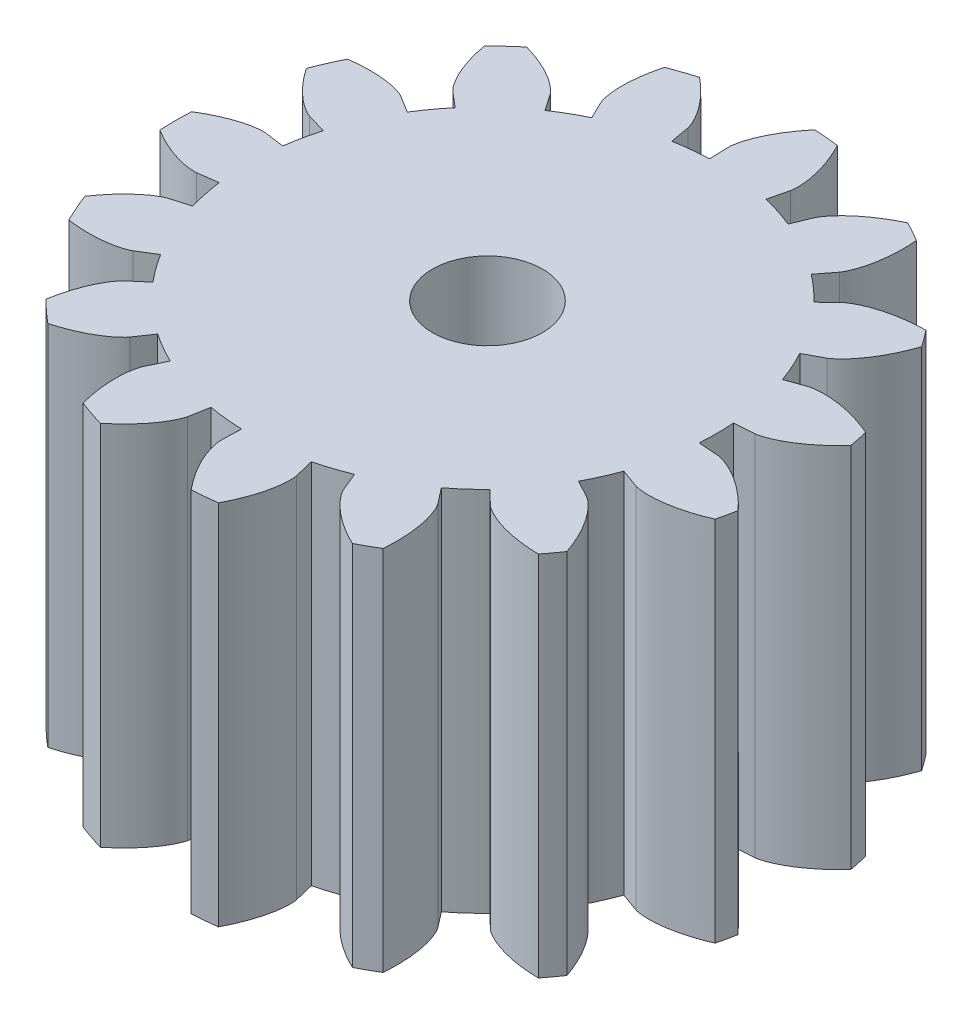
from build123d import *

# Parameters (mm, degrees)
IZIM2_R                     = 8.5
Y_KSEKLIK_EKSTR_ZYON1_DEPTH = 10
KES_EKSTR_ZYON1_DEPTH       = 10
DAIRESEL_KAPLAMA1_DEPTH     = 10
IZIM4_R                     = 1.5
KES_EKSTR_ZYON2_DEPTH       = 10


# Read off the part's stored shape, not the designer's step: Dairesel Kaplama1
with BuildPart() as part:
    # Çizim2 → Yükseklik-Ekstrüzyon1 (new body)
    with BuildSketch(Plane(origin=(0, 0, 0), x_dir=(1, 0, 0), z_dir=(0, 1, 0))):
        with Locations(Location((0, 0, 0), (0, 0, 270))):
            Circle(IZIM2_R)
    extrude(amount=Y_KSEKLIK_EKSTR_ZYON1_DEPTH)

    # Çizim3 → Kes-Ekstrüzyon1 (cut)
    with BuildSketch(Plane(origin=(0, 0, 0), x_dir=(1, 0, 0), z_dir=(0, 1, 0))):
        with BuildLine():
            add(Edge.make_bspline(
                [(6.778329888, 0.507587872), (6.781151553, 0.507844299), (6.78905244, 0.508702265), (6.803933483, 0.510871839), (6.828112192, 0.515186865), (6.872789151, 0.52486054), (6.925921196, 0.539194402), (6.98535488, 0.558049096), (7.048582566, 0.580958795), (7.102206918, 0.602179379), (7.155264884, 0.624857332), (7.207707286, 0.648803305), (7.270713626, 0.679398072), (7.340331798, 0.715586875), (7.396390413, 0.746971028), (7.439228346, 0.772141506), (7.458914159, 0.783964013)],
                knots=[0, 0, 0, 0, 0, 0.005376749, 0.015083688, 0.02853182, 0.046610139, 0.092110525, 0.119476176, 0.146842496, 0.174208854, 0.201574956, 0.228941013, 0.256307345, 0.307035032, 0.35065054, 0.35065054, 0.35065054, 0.35065054, 0.35065054], degree=4))
            Line((6.778329888, 0.507587872), (6.776027931, 0.507415492))
            ThreePointArc((6.776027931, 0.507415492), (6.790255326, 0.253885024), (6.795, 0))
            ThreePointArc((6.795, 0), (6.790255326, -0.253885024), (6.776027931, -0.507415492))
            Line((6.776027931, -0.507415492), (6.778329888, -0.507587872))
            add(Edge.make_bspline(
                [(6.778329888, -0.507587872), (6.781151553, -0.507844299), (6.78905244, -0.508702265), (6.803933483, -0.510871839), (6.828112192, -0.515186865), (6.872789151, -0.52486054), (6.925921196, -0.539194402), (6.98535488, -0.558049096), (7.048582566, -0.580958795), (7.102206918, -0.602179379), (7.155264884, -0.624857332), (7.207707286, -0.648803305), (7.270713626, -0.679398072), (7.340331798, -0.715586875), (7.396390413, -0.746971028), (7.439228346, -0.772141506), (7.458914159, -0.783964013)],
                knots=[0, 0, 0, 0, 0, 0.005376749, 0.015083688, 0.02853182, 0.046610139, 0.092110525, 0.119476176, 0.146842496, 0.174208854, 0.201574956, 0.228941013, 0.256307345, 0.307035032, 0.35065054, 0.35065054, 0.35065054, 0.35065054, 0.35065054], degree=4))
            ThreePointArc((7.458914159, -0.783964013), (7.489721496, -0.392519942), (7.5, 0))
            ThreePointArc((7.5, 0), (7.489721496, 0.392519942), (7.458914159, 0.783964013))
        make_face()
        with BuildLine():
            ThreePointArc((6.795, 0), (6.790255326, 0.253885024), (6.776027931, 0.507415492))
            Line((6.776027931, 0.507415492), (6.232549605, 0.466717708))
            ThreePointArc((6.232549605, 0.466717708), (6.245635878, 0.233521913), (6.25, 0))
            ThreePointArc((6.25, 0), (6.245635878, -0.233521913), (6.232549605, -0.466717708))
            Line((6.232549605, -0.466717708), (6.776027931, -0.507415492))
            ThreePointArc((6.776027931, -0.507415492), (6.790255326, -0.253885024), (6.795, 0))
        make_face()
        with BuildLine():
            add(Edge.make_bspline(
                [(7.458914159, 0.783964013), (7.46393172, 0.786977358), (7.493607067, 0.804898134), (7.547467466, 0.838496906), (7.624836133, 0.889663526), (7.718514983, 0.955731482), (7.811457228, 1.026089784), (7.90016559, 1.096716979), (7.990429253, 1.173683928), (8.072801253, 1.246571514), (8.162893515, 1.332136353), (8.234967779, 1.402336669), (8.307514849, 1.478047302), (8.342539168, 1.515364187), (8.360317377, 1.534631343)],
                knots=[0.35065054, 0.35065054, 0.35065054, 0.35065054, 0.35065054, 0.361767352, 0.416499661, 0.471231937, 0.525964282, 0.580696615, 0.635428982, 0.690161387, 0.744893688, 0.799626082, 0.854358408, 0.909090915, 0.909090915, 0.909090915, 0.909090915, 0.909090915], degree=4))
            ThreePointArc((7.458914159, 0.783964013), (7.489721496, 0.392519942), (7.5, 0))
            ThreePointArc((7.5, 0), (7.489721496, -0.392519942), (7.458914159, -0.783964013))
            add(Edge.make_bspline(
                [(7.458914159, -0.783964013), (7.46393172, -0.786977358), (7.493607067, -0.804898134), (7.547467466, -0.838496906), (7.624836133, -0.889663526), (7.718514983, -0.955731482), (7.811457228, -1.026089784), (7.90016559, -1.096716979), (7.990429253, -1.173683928), (8.072801253, -1.246571514), (8.162893515, -1.332136353), (8.234967779, -1.402336669), (8.307514849, -1.478047302), (8.342539168, -1.515364187), (8.360317377, -1.534631343)],
                knots=[0.35065054, 0.35065054, 0.35065054, 0.35065054, 0.35065054, 0.361767352, 0.416499661, 0.471231937, 0.525964282, 0.580696615, 0.635428982, 0.690161387, 0.744893688, 0.799626082, 0.854358408, 0.909090915, 0.909090915, 0.909090915, 0.909090915, 0.909090915], degree=4))
            ThreePointArc((8.360317377, -1.534631343), (8.465007315, -0.770487605), (8.5, 0))
            ThreePointArc((8.5, 0), (8.465007315, 0.770487605), (8.360317377, 1.534631343))
        make_face()
    extrude(amount=KES_EKSTR_ZYON1_DEPTH, mode=Mode.SUBTRACT)

    # Dairesel Kaplama1 outline → Dairesel Kaplama1 (cut)
    with BuildSketch(Plane(origin=(0, 0, 0), x_dir=(1, 0, 0), z_dir=(0, 1, 0))):
        with BuildLine():
            add(Edge.make_bspline(
                [(5.975031867, -3.271632687), (5.977505288, -3.27301462), (5.98437414, -3.277011991), (5.997086205, -3.28504666), (6.017419475, -3.298823), (6.05429927, -3.325832098), (6.097007702, -3.360537482), (6.143634178, -3.40193596), (6.19207733, -3.448582028), (6.232434424, -3.489778985), (6.271681333, -3.532076945), (6.309850147, -3.575282926), (6.35496529, -3.628859624), (6.407490408, -3.694812939), (6.466533083, -3.774324793), (6.530674632, -3.867311635), (6.592949632, -3.964981273), (6.651657262, -4.063439976), (6.707946928, -4.1655185), (6.76025938, -4.266120594), (6.811414062, -4.37314694), (6.857018576, -4.473236774), (6.904519597, -4.588047968), (6.939604905, -4.675969394), (6.971743014, -4.76478739), (6.987872452, -4.81067419), (6.99448009, -4.82982901)],
                knots=[0, 0, 0, 0, 0, 0.005376749, 0.015083688, 0.02853182, 0.046610139, 0.092110525, 0.119476176, 0.146842496, 0.174208854, 0.201574956, 0.228941013, 0.256307345, 0.307035032, 0.361767352, 0.416499661, 0.471231937, 0.525964282, 0.580696615, 0.635428982, 0.690161387, 0.744893688, 0.799626082, 0.854358408, 0.896146756, 0.896146756, 0.896146756, 0.896146756, 0.896146756], degree=4))
            ThreePointArc((6.99448009, -4.82982901), (7.747434148, -3.496750508), (8.249034838, -2.050225412))
            add(Edge.make_bspline(
                [(6.387941041, -2.344223498), (6.390623058, -2.345136914), (6.398189844, -2.347566703), (6.412666798, -2.351637365), (6.436510228, -2.357529759), (6.481259298, -2.366864174), (6.535627944, -2.375380289), (6.597592211, -2.382329526), (6.66467179, -2.387117491), (6.722291262, -2.389542512), (6.77998608, -2.39040579), (6.837634303, -2.389860302), (6.907637472, -2.387537579), (6.991796502, -2.382439966), (7.090392585, -2.37311341), (7.202414349, -2.358559528), (7.316667144, -2.339485128), (7.429119291, -2.317231668), (7.542643556, -2.290759177), (7.652409345, -2.262318965), (7.766174584, -2.228719698), (7.871071202, -2.195637286), (7.988176933, -2.15411374), (8.082117127, -2.119465976), (8.178393178, -2.080150513), (8.225444786, -2.060372236), (8.249034838, -2.050225412)],
                knots=[0, 0, 0, 0, 0, 0.005376749, 0.015083688, 0.02853182, 0.046610139, 0.092110525, 0.119476176, 0.146842496, 0.174208854, 0.201574956, 0.228941013, 0.256307345, 0.307035032, 0.361767352, 0.416499661, 0.471231937, 0.525964282, 0.580696615, 0.635428982, 0.690161387, 0.744893688, 0.799626082, 0.854358408, 0.908033413, 0.908033413, 0.908033413, 0.908033413, 0.908033413], degree=4))
            Line((6.387941041, -2.344223498), (5.872722549, -2.15957141))
            ThreePointArc((5.872722549, -2.15957141), (5.698833084, -2.593036967), (5.493060161, -3.012307094))
            Line((5.493060161, -3.012307094), (5.975031867, -3.271632687))
        make_face()
        with BuildLine():
            add(Edge.make_bspline(
                [(4.116944298, -5.469982532), (4.118641798, -5.472251021), (4.12329093, -5.478696616), (4.131635984, -5.491207114), (4.144608009, -5.512062713), (4.167313788, -5.551737115), (4.192213931, -5.600813145), (4.217971059, -5.657597233), (4.243253414, -5.719914142), (4.263365143, -5.773964143), (4.282014848, -5.828568409), (4.299310339, -5.883563692), (4.318733466, -5.950858422), (4.339891919, -6.032473665), (4.361489703, -6.129126177), (4.382264767, -6.240162602), (4.399429989, -6.354717781), (4.413015316, -6.468542826), (4.422919408, -6.584691267), (4.429790654, -6.697873245), (4.432991244, -6.816453161), (4.433942838, -6.926438801), (4.43063926, -7.050644451), (4.427345739, -7.134642784), (4.422134126, -7.211287058), (4.419091225, -7.251471198), (4.418315087, -7.261438686)],
                knots=[0, 0, 0, 0, 0, 0.005376749, 0.015083688, 0.02853182, 0.046610139, 0.092110525, 0.119476176, 0.146842496, 0.174208854, 0.201574956, 0.228941013, 0.256307345, 0.307035032, 0.361767352, 0.416499661, 0.471231937, 0.525964282, 0.580696615, 0.635428982, 0.690161387, 0.744893688, 0.799626082, 0.854358408, 0.873080296, 0.873080296, 0.873080296, 0.873080296, 0.873080296], degree=4))
            ThreePointArc((4.418315087, -7.261438686), (5.628305831, -6.36962899), (6.662288185, -5.278628245))
            add(Edge.make_bspline(
                [(4.871366899, -4.790697371), (4.873445524, -4.792622694), (4.879369842, -4.797920105), (4.890939511, -4.807527147), (4.910324915, -4.822608114), (4.947408577, -4.849336612), (4.99361299, -4.879230192), (5.047393655, -4.910781773), (5.10672646, -4.94243952), (5.158378121, -4.968090837), (5.210733834, -4.992346078), (5.263619976, -5.015295394), (5.328515789, -5.041646335), (5.407472274, -5.071219995), (5.501337731, -5.102802403), (5.609594301, -5.135070126), (5.721727681, -5.164115592), (5.833509127, -5.189524454), (5.947986035, -5.211515109), (6.05982975, -5.230179451), (6.177425519, -5.245757484), (6.286709178, -5.258200495), (6.410579735, -5.267898041), (6.503618726, -5.274003671), (6.595584008, -5.277087411), (6.643348189, -5.278261712), (6.662288185, -5.278628245)],
                knots=[0, 0, 0, 0, 0, 0.005376749, 0.015083688, 0.02853182, 0.046610139, 0.092110525, 0.119476176, 0.146842496, 0.174208854, 0.201574956, 0.228941013, 0.256307345, 0.307035032, 0.361767352, 0.416499661, 0.471231937, 0.525964282, 0.580696615, 0.635428982, 0.690161387, 0.744893688, 0.799626082, 0.854358408, 0.893047583, 0.893047583, 0.893047583, 0.893047583, 0.893047583], degree=4))
            Line((4.871366899, -4.790697371), (4.475796157, -4.412451055))
            ThreePointArc((4.475796157, -4.412451055), (4.1406339, -4.737714329), (3.782118457, -5.037041261))
            Line((3.782118457, -5.037041261), (4.116944298, -5.469982532))
        make_face()
        with BuildLine():
            add(Edge.make_bspline(
                [(1.525347404, -6.722522747), (1.52597547, -6.72528555), (1.527601003, -6.733064866), (1.530136112, -6.747888014), (1.53350391, -6.77221675), (1.538109638, -6.817696392), (1.54089603, -6.872657377), (1.541330168, -6.93500859), (1.539080179, -7.00222118), (1.535469041, -7.05977849), (1.530296839, -7.117247487), (1.523728459, -7.174522888), (1.514101136, -7.243899781), (1.500234435, -7.327064933), (1.480652874, -7.424146006), (1.454469257, -7.534032808), (1.423556679, -7.645665897), (1.389670676, -7.7551759), (1.351476687, -7.865311138), (1.311718624, -7.971502807), (1.266411712, -8.081132748), (1.222545846, -8.181996678), (1.171056435, -8.289832272), (1.139060587, -8.354855087), (1.112822691, -8.405213882), (1.100522606, -8.428454781)],
                knots=[0, 0, 0, 0, 0, 0.005376749, 0.015083688, 0.02853182, 0.046610139, 0.092110525, 0.119476176, 0.146842496, 0.174208854, 0.201574956, 0.228941013, 0.256307345, 0.307035032, 0.361767352, 0.416499661, 0.471231937, 0.525964282, 0.580696615, 0.635428982, 0.690161387, 0.744893688, 0.799626082, 0.84598535, 0.84598535, 0.84598535, 0.84598535, 0.84598535], degree=4))
            ThreePointArc((1.100522606, -8.428454781), (2.529108361, -8.115023777), (3.882815137, -7.561332331))
            add(Edge.make_bspline(
                [(2.49083691, -6.40881619), (2.491952729, -6.411420513), (2.495210212, -6.418669576), (2.501872094, -6.432151854), (2.51344756, -6.453813757), (2.536453711, -6.493314739), (2.566504729, -6.53941691), (2.602802627, -6.590115282), (2.644129475, -6.643168898), (2.680882286, -6.687611166), (2.718846114, -6.731064418), (2.757825681, -6.773540394), (2.806393063, -6.824008681), (2.86649471, -6.88314006), (2.939399349, -6.950170545), (3.025172182, -7.023680491), (3.115797266, -7.095823599), (3.207579983, -7.16450136), (3.303215438, -7.231152776), (3.397798283, -7.293694438), (3.498891208, -7.355756188), (3.593665769, -7.411573113), (3.702882806, -7.470814956), (3.775437882, -7.508995496), (3.841417062, -7.541396663), (3.87584518, -7.557987302), (3.882815137, -7.561332331)],
                knots=[0, 0, 0, 0, 0, 0.005376749, 0.015083688, 0.02853182, 0.046610139, 0.092110525, 0.119476176, 0.146842496, 0.174208854, 0.201574956, 0.228941013, 0.256307345, 0.307035032, 0.361767352, 0.416499661, 0.471231937, 0.525964282, 0.580696615, 0.635428982, 0.690161387, 0.744893688, 0.799626082, 0.854358408, 0.868564889, 0.868564889, 0.868564889, 0.868564889, 0.868564889], degree=4))
            Line((2.49083691, -6.40881619), (2.283311692, -5.90237787))
            ThreePointArc((2.283311692, -5.90237787), (1.844829243, -6.063197885), (1.395561857, -6.190825277))
            Line((1.395561857, -6.190825277), (1.525347404, -6.722522747))
        make_face()
        with BuildLine():
            add(Edge.make_bspline(
                [(-1.351648169, -6.81267775), (-1.352198136, -6.815457154), (-1.35387727, -6.823225077), (-1.357590451, -6.837797818), (-1.364409202, -6.86139303), (-1.378699898, -6.90481407), (-1.398509048, -6.956156756), (-1.423472966, -7.013294003), (-1.452866256, -7.073780606), (-1.479575862, -7.124893043), (-1.507675651, -7.17528986), (-1.536972169, -7.224941942), (-1.573985291, -7.284405102), (-1.620479467, -7.354740154), (-1.677854543, -7.435463589), (-1.746469457, -7.525200341), (-1.82011477, -7.614608963), (-1.895612905, -7.70086865), (-1.975300887, -7.785947302), (-2.054813727, -7.866787158), (-2.140794166, -7.948511111), (-2.221892684, -8.022813041), (-2.300375243, -8.089787654), (-2.34752067, -8.129271755), (-2.376699495, -8.152991761), (-2.383950754, -8.158846659)],
                knots=[0, 0, 0, 0, 0, 0.005376749, 0.015083688, 0.02853182, 0.046610139, 0.092110525, 0.119476176, 0.146842496, 0.174208854, 0.201574956, 0.228941013, 0.256307345, 0.307035032, 0.361767352, 0.416499661, 0.471231937, 0.525964282, 0.580696615, 0.635428982, 0.690161387, 0.744893688, 0.799626082, 0.817224979, 0.817224979, 0.817224979, 0.817224979, 0.817224979], degree=4))
            ThreePointArc((-2.383950754, -8.158846659), (-0.995677657, -8.441482453), (0.42025647, -8.489604496))
            add(Edge.make_bspline(
                [(-0.342033664, -6.91879251), (-0.342073586, -6.921625522), (-0.342046188, -6.929572809), (-0.341443992, -6.944599114), (-0.339679967, -6.969096413), (-0.334729299, -7.014539801), (-0.326027771, -7.06887908), (-0.313488876, -7.129958032), (-0.297313772, -7.195234066), (-0.281814708, -7.250782813), (-0.264807054, -7.305920613), (-0.246473984, -7.360578766), (-0.222632774, -7.426437975), (-0.191778086, -7.50490272), (-0.152440139, -7.595791103), (-0.103981946, -7.697832734), (-0.050535058, -7.800599286), (0.005378865, -7.900670936), (0.065636627, -8.000458479), (0.12660437, -8.096063439), (0.193714564, -8.193877865), (0.257592645, -8.28341745), (0.328484558, -8.375726926), (0.372032345, -8.431122642), (0.405516826, -8.471885373), (0.42025647, -8.489604496)],
                knots=[0, 0, 0, 0, 0, 0.005376749, 0.015083688, 0.02853182, 0.046610139, 0.092110525, 0.119476176, 0.146842496, 0.174208854, 0.201574956, 0.228941013, 0.256307345, 0.307035032, 0.361767352, 0.416499661, 0.471231937, 0.525964282, 0.580696615, 0.635428982, 0.690161387, 0.744893688, 0.799626082, 0.840510263, 0.840510263, 0.840510263, 0.840510263, 0.840510263], degree=4))
            Line((-0.342033664, -6.91879251), (-0.325630363, -6.371729973))
            ThreePointArc((-0.325630363, -6.371729973), (-0.791615405, -6.340299488), (-1.253952322, -6.274159404))
            Line((-1.253952322, -6.274159404), (-1.351648169, -6.81267775))
        make_face()
        with BuildLine():
            add(Edge.make_bspline(
                [(-4.01658375, -5.724858922), (-4.018216655, -5.727174342), (-4.022910119, -5.733587727), (-4.032229546, -5.745390302), (-4.048055823, -5.764172165), (-4.078771951, -5.798026709), (-4.117751462, -5.836873479), (-4.163796948, -5.878917212), (-4.215251173, -5.922219145), (-4.260440913, -5.958048904), (-4.306609579, -5.992659474), (-4.353568601, -6.02610294), (-4.411567617, -6.065370647), (-4.482650003, -6.110714029), (-4.567897923, -6.16112201), (-4.66707999, -6.215192413), (-4.770724095, -6.266917007), (-4.874780048, -6.315011293), (-4.982183248, -6.360322487), (-5.087702374, -6.401832585), (-5.199489539, -6.441519736), (-5.299231405, -6.474884593), (-5.382763997, -6.499757305), (-5.43143628, -6.51382765), (-5.453386029, -6.520013867)],
                knots=[0, 0, 0, 0, 0, 0.005376749, 0.015083688, 0.02853182, 0.046610139, 0.092110525, 0.119476176, 0.146842496, 0.174208854, 0.201574956, 0.228941013, 0.256307345, 0.307035032, 0.361767352, 0.416499661, 0.471231937, 0.525964282, 0.580696615, 0.635428982, 0.690161387, 0.744893688, 0.790041332, 0.790041332, 0.790041332, 0.790041332, 0.790041332], degree=4))
            ThreePointArc((-5.453386029, -6.520013867), (-4.331717522, -7.313427604), (-3.096876039, -7.91576647))
            add(Edge.make_bspline(
                [(-3.137415767, -6.232446794), (-3.138604527, -6.235018641), (-3.141811949, -6.242289993), (-3.147373565, -6.256262141), (-3.155725997, -6.27935903), (-3.169686829, -6.322887249), (-3.183839363, -6.376067881), (-3.19722756, -6.436966308), (-3.209001022, -6.50317794), (-3.217435634, -6.560228283), (-3.224324933, -6.617516806), (-3.229808314, -6.674906245), (-3.234815638, -6.744768719), (-3.238542965, -6.828999563), (-3.239573598, -6.928030417), (-3.236808906, -7.040959809), (-3.229781666, -7.156580533), (-3.219404563, -7.270742775), (-3.204943609, -7.386412271), (-3.188132844, -7.498549563), (-3.166609343, -7.615203664), (-3.144672842, -7.722983701), (-3.121365867, -7.819888578), (-3.107069505, -7.877126131), (-3.098400982, -7.910028668), (-3.096876039, -7.91576647)],
                knots=[0, 0, 0, 0, 0, 0.005376749, 0.015083688, 0.02853182, 0.046610139, 0.092110525, 0.119476176, 0.146842496, 0.174208854, 0.201574956, 0.228941013, 0.256307345, 0.307035032, 0.361767352, 0.416499661, 0.471231937, 0.525964282, 0.580696615, 0.635428982, 0.690161387, 0.744893688, 0.799626082, 0.811045869, 0.811045869, 0.811045869, 0.811045869, 0.811045869], degree=4))
            Line((-3.137415767, -6.232446794), (-2.899920225, -5.739352122))
            ThreePointArc((-2.899920225, -5.739352122), (-3.312834814, -5.521105753), (-3.708299008, -5.272634414))
            Line((-3.708299008, -5.272634414), (-4.01658375, -5.724858922))
        make_face()
        with BuildLine():
            add(Edge.make_bspline(
                [(-6.008667766, -3.647160021), (-6.011101265, -3.6486111), (-6.017997517, -3.652561015), (-6.031311777, -3.659552651), (-6.053409073, -3.67027361), (-6.095239535, -3.6887079), (-6.146649495, -3.708341795), (-6.205814866, -3.72802227), (-6.270433122, -3.746652235), (-6.32628928, -3.761004026), (-6.382543843, -3.773843866), (-6.439045727, -3.785296038), (-6.50800208, -3.797578549), (-6.591381886, -3.810089977), (-6.689762508, -3.821466508), (-6.80236225, -3.830521297), (-6.918084138, -3.83561821), (-7.032705691, -3.837231157), (-7.149253119, -3.834940176), (-7.262533314, -3.829943042), (-7.38079819, -3.820731122), (-7.475903542, -3.811566331), (-7.550628734, -3.802120768), (-7.592655648, -3.796465659), (-7.605968064, -3.794634345)],
                knots=[0, 0, 0, 0, 0, 0.005376749, 0.015083688, 0.02853182, 0.046610139, 0.092110525, 0.119476176, 0.146842496, 0.174208854, 0.201574956, 0.228941013, 0.256307345, 0.307035032, 0.361767352, 0.416499661, 0.471231937, 0.525964282, 0.580696615, 0.635428982, 0.690161387, 0.744893688, 0.770876286, 0.770876286, 0.770876286, 0.770876286, 0.770876286], degree=4))
            ThreePointArc((-7.605968064, -3.794634345), (-6.91441877, -4.943765071), (-6.050727546, -5.969815422))
            add(Edge.make_bspline(
                [(-5.411962436, -4.468454449), (-5.414094487, -4.470320437), (-5.419982138, -4.475658571), (-5.430745912, -4.48616065), (-5.447770589, -4.503863468), (-5.478228965, -4.537950093), (-5.51278846, -4.580776664), (-5.549788809, -4.630964675), (-5.587475098, -4.686663312), (-5.618384964, -4.735350728), (-5.647979994, -4.784884267), (-5.676331699, -4.835081837), (-5.709321746, -4.896867721), (-5.746986599, -4.972300385), (-5.788207606, -5.062350376), (-5.831614456, -5.16664101), (-5.872221938, -5.275124033), (-5.909175951, -5.383637179), (-5.943012234, -5.495188322), (-5.973265182, -5.60446839), (-6.001049982, -5.71979161), (-6.023223523, -5.819845443), (-6.038700401, -5.902220805), (-6.047270706, -5.949949961), (-6.050727546, -5.969815422)],
                knots=[0, 0, 0, 0, 0, 0.005376749, 0.015083688, 0.02853182, 0.046610139, 0.092110525, 0.119476176, 0.146842496, 0.174208854, 0.201574956, 0.228941013, 0.256307345, 0.307035032, 0.361767352, 0.416499661, 0.471231937, 0.525964282, 0.580696615, 0.635428982, 0.690161387, 0.744893688, 0.784681032, 0.784681032, 0.784681032, 0.784681032, 0.784681032], degree=4))
            Line((-5.411962436, -4.468454449), (-4.994439791, -4.114588191))
            ThreePointArc((-4.994439791, -4.114588191), (-5.282887243, -3.747262718), (-5.543099363, -3.359423076))
            Line((-5.543099363, -3.359423076), (-6.008667766, -3.647160021))
        make_face()
        with BuildLine():
            add(Edge.make_bspline(
                [(-6.983450794, -0.938834061), (-6.986264113, -0.939169895), (-6.994170728, -0.939973364), (-7.009177664, -0.940945144), (-7.033725155, -0.941751447), (-7.079437085, -0.941578027), (-7.134388245, -0.938604169), (-7.196443272, -0.932518452), (-7.263052475, -0.92325516), (-7.319917014, -0.913647427), (-7.376530548, -0.902496413), (-7.432805605, -0.889977106), (-7.500796115, -0.873150662), (-7.582056215, -0.850666798), (-7.676558638, -0.821044772), (-7.783106535, -0.783518293), (-7.890896841, -0.741106222), (-7.996264885, -0.695958937), (-8.101804432, -0.646461912), (-8.203258523, -0.595821596), (-8.307552037, -0.539303431), (-8.387340748, -0.494153263), (-8.447822747, -0.457644528), (-8.480835352, -0.437360683), (-8.488998614, -0.432322245)],
                knots=[0, 0, 0, 0, 0, 0.005376749, 0.015083688, 0.02853182, 0.046610139, 0.092110525, 0.119476176, 0.146842496, 0.174208854, 0.201574956, 0.228941013, 0.256307345, 0.307035032, 0.361767352, 0.416499661, 0.471231937, 0.525964282, 0.580696615, 0.635428982, 0.690161387, 0.744893688, 0.763176522, 0.763176522, 0.763176522, 0.763176522, 0.763176522], degree=4))
            ThreePointArc((-8.488998614, -0.432322245), (-8.318987795, -1.744832964), (-7.947296148, -3.015042942))
            add(Edge.make_bspline(
                [(-6.772383889, -1.931825779), (-6.77509058, -1.93266326), (-6.782640432, -1.935145165), (-6.796745208, -1.940361271), (-6.819498411, -1.94960904), (-6.8611878, -1.968360184), (-6.910178606, -1.993427589), (-6.964393409, -2.024227221), (-7.021476225, -2.059782064), (-7.069516748, -2.091688056), (-7.116700259, -2.124901813), (-7.163018021, -2.159227897), (-7.218286512, -2.20225385), (-7.283376295, -2.255845341), (-7.357660191, -2.321344007), (-7.439733144, -2.398963086), (-7.520953945, -2.481550708), (-7.598849388, -2.565651849), (-7.675132308, -2.653796433), (-7.74721796, -2.74132376), (-7.819506817, -2.835375667), (-7.875440794, -2.910977937), (-7.91741962, -2.971310676), (-7.9405702, -3.005155648), (-7.947296148, -3.015042942)],
                knots=[0, 0, 0, 0, 0, 0.005376749, 0.015083688, 0.02853182, 0.046610139, 0.092110525, 0.119476176, 0.146842496, 0.174208854, 0.201574956, 0.228941013, 0.256307345, 0.307035032, 0.361767352, 0.416499661, 0.471231937, 0.525964282, 0.580696615, 0.635428982, 0.690161387, 0.744893688, 0.767887212, 0.767887212, 0.767887212, 0.767887212, 0.767887212], degree=4))
            Line((-6.772383889, -1.931825779), (-6.247027599, -1.778374625))
            ThreePointArc((-6.247027599, -1.778374625), (-6.361132729, -1.32548396), (-6.441099735, -0.865337013))
            Line((-6.441099735, -0.865337013), (-6.983450794, -0.938834061))
        make_face()
        with BuildLine():
            add(Edge.make_bspline(
                [(-6.772383992, 1.931824793), (-6.775090683, 1.932662274), (-6.782640535, 1.935144178), (-6.796745312, 1.940360284), (-6.819498514, 1.949608053), (-6.861187904, 1.968359197), (-6.910178709, 1.993426603), (-6.964393513, 2.024226235), (-7.021476328, 2.059781077), (-7.069516852, 2.091687069), (-7.116700362, 2.124900826), (-7.163018125, 2.15922691), (-7.218286615, 2.202252863), (-7.283376399, 2.255844355), (-7.357660294, 2.321343021), (-7.439733247, 2.3989621), (-7.520954049, 2.481549722), (-7.598849492, 2.565650863), (-7.675132412, 2.653795446), (-7.747218063, 2.741322773), (-7.819506921, 2.835374681), (-7.875440942, 2.91097701), (-7.917419818, 2.971309825), (-7.940570437, 3.005154855), (-7.947296425, 3.015042211)],
                knots=[0, 0, 0, 0, 0, 0.005376749, 0.015083688, 0.02853182, 0.046610139, 0.092110525, 0.119476176, 0.146842496, 0.174208854, 0.201574956, 0.228941013, 0.256307345, 0.307035032, 0.361767352, 0.416499661, 0.471231937, 0.525964282, 0.580696615, 0.635428982, 0.690161387, 0.744893688, 0.767887361, 0.767887361, 0.767887361, 0.767887361, 0.767887361], degree=4))
            ThreePointArc((-7.947296425, 3.015042211), (-8.318987973, 1.744832115), (-8.488998663, 0.432321292))
            add(Edge.make_bspline(
                [(-6.983450898, 0.938833075), (-6.986264217, 0.939168908), (-6.994170832, 0.939972377), (-7.009177768, 0.940944157), (-7.033725259, 0.941750461), (-7.079437189, 0.941577041), (-7.134388349, 0.938603182), (-7.196443375, 0.932517465), (-7.263052579, 0.923254173), (-7.319917118, 0.91364644), (-7.376530651, 0.902495426), (-7.432805709, 0.889976119), (-7.500796219, 0.873149675), (-7.582056319, 0.850665812), (-7.676558741, 0.821043785), (-7.783106638, 0.783517306), (-7.890896945, 0.741105235), (-7.996264989, 0.695957951), (-8.101804536, 0.646460926), (-8.203258626, 0.59582061), (-8.307552141, 0.539302444), (-8.387340838, 0.494152284), (-8.447822821, 0.457643559), (-8.480835414, 0.437359723), (-8.488998663, 0.432321292)],
                knots=[0, 0, 0, 0, 0, 0.005376749, 0.015083688, 0.02853182, 0.046610139, 0.092110525, 0.119476176, 0.146842496, 0.174208854, 0.201574956, 0.228941013, 0.256307345, 0.307035032, 0.361767352, 0.416499661, 0.471231937, 0.525964282, 0.580696615, 0.635428982, 0.690161387, 0.744893688, 0.763176491, 0.763176491, 0.763176491, 0.763176491, 0.763176491], degree=4))
            Line((-6.983450898, 0.938833075), (-6.441099839, 0.865336026))
            ThreePointArc((-6.441099839, 0.865336026), (-6.361132833, 1.325482974), (-6.247027703, 1.778373639))
            Line((-6.247027703, 1.778373639), (-6.772383992, 1.931824793))
        make_face()
        with BuildLine():
            add(Edge.make_bspline(
                [(-5.411962729, 4.468453547), (-5.41409478, 4.470319534), (-5.419982431, 4.475657668), (-5.430746205, 4.486159748), (-5.447770883, 4.503862566), (-5.478229258, 4.537949191), (-5.512788753, 4.580775761), (-5.549789102, 4.630963772), (-5.587475391, 4.68666241), (-5.618385257, 4.735349826), (-5.647980287, 4.784883365), (-5.676331992, 4.835080934), (-5.709322039, 4.896866819), (-5.746986892, 4.972299482), (-5.788207899, 5.062349473), (-5.831614749, 5.166640108), (-5.872222232, 5.275123131), (-5.909176244, 5.383636277), (-5.943012527, 5.49518742), (-5.973265475, 5.604467488), (-6.001050275, 5.719790708), (-6.023223844, 5.819844668), (-6.038700747, 5.902220187), (-6.047271069, 5.949949449), (-6.050727928, 5.969815034)],
                knots=[0, 0, 0, 0, 0, 0.005376749, 0.015083688, 0.02853182, 0.046610139, 0.092110525, 0.119476176, 0.146842496, 0.174208854, 0.201574956, 0.228941013, 0.256307345, 0.307035032, 0.361767352, 0.416499661, 0.471231937, 0.525964282, 0.580696615, 0.635428982, 0.690161387, 0.744893688, 0.78468129, 0.78468129, 0.78468129, 0.78468129, 0.78468129], degree=4))
            ThreePointArc((-6.050727928, 5.969815034), (-6.914419229, 4.943764429), (-7.605968525, 3.79463342))
            add(Edge.make_bspline(
                [(-6.008668059, 3.647159118), (-6.011101559, 3.648610197), (-6.01799781, 3.652560113), (-6.03131207, 3.659551749), (-6.053409366, 3.670272708), (-6.095239828, 3.688706998), (-6.146649788, 3.708340893), (-6.20581516, 3.728021367), (-6.270433416, 3.746651333), (-6.326289574, 3.761003123), (-6.382544136, 3.773842964), (-6.43904602, 3.785295136), (-6.508002373, 3.797577646), (-6.591382179, 3.810089075), (-6.689762802, 3.821465605), (-6.802362543, 3.830520395), (-6.918084432, 3.835617307), (-7.032705984, 3.837230255), (-7.149253412, 3.834939274), (-7.262533608, 3.82994214), (-7.380798483, 3.82073022), (-7.475903876, 3.811565425), (-7.550629118, 3.802119855), (-7.592656069, 3.796464739), (-7.605968525, 3.79463342)],
                knots=[0, 0, 0, 0, 0, 0.005376749, 0.015083688, 0.02853182, 0.046610139, 0.092110525, 0.119476176, 0.146842496, 0.174208854, 0.201574956, 0.228941013, 0.256307345, 0.307035032, 0.361767352, 0.416499661, 0.471231937, 0.525964282, 0.580696615, 0.635428982, 0.690161387, 0.744893688, 0.770876369, 0.770876369, 0.770876369, 0.770876369, 0.770876369], degree=4))
            Line((-6.008668059, 3.647159118), (-5.543099656, 3.359422174))
            ThreePointArc((-5.543099656, 3.359422174), (-5.282887536, 3.747261816), (-4.994440084, 4.114587289))
            Line((-4.994440084, 4.114587289), (-5.411962729, 4.468453547))
        make_face()
        with BuildLine():
            add(Edge.make_bspline(
                [(-3.137416199, 6.232446046), (-3.138604959, 6.235017893), (-3.141812381, 6.242289245), (-3.147373997, 6.256261393), (-3.155726429, 6.279358282), (-3.16968726, 6.322886501), (-3.183839795, 6.376067133), (-3.197227992, 6.43696556), (-3.209001454, 6.503177192), (-3.217436065, 6.560227535), (-3.224325365, 6.617516058), (-3.229808745, 6.674905496), (-3.23481607, 6.744767971), (-3.238543397, 6.828998814), (-3.23957403, 6.928029669), (-3.236809338, 7.04095906), (-3.229782098, 7.156579785), (-3.219404995, 7.270742027), (-3.204944041, 7.386411523), (-3.188133276, 7.498548815), (-3.166609775, 7.615202916), (-3.144673274, 7.722982953), (-3.121366257, 7.819888007), (-3.107069861, 7.877125688), (-3.098401288, 7.9100284), (-3.096876299, 7.915766368)],
                knots=[0, 0, 0, 0, 0, 0.005376749, 0.015083688, 0.02853182, 0.046610139, 0.092110525, 0.119476176, 0.146842496, 0.174208854, 0.201574956, 0.228941013, 0.256307345, 0.307035032, 0.361767352, 0.416499661, 0.471231937, 0.525964282, 0.580696615, 0.635428982, 0.690161387, 0.744893688, 0.799626082, 0.811046191, 0.811046191, 0.811046191, 0.811046191, 0.811046191], degree=4))
            ThreePointArc((-3.096876299, 7.915766368), (-4.331718078, 7.313427274), (-5.453386807, 6.520013216))
            add(Edge.make_bspline(
                [(-4.016584182, 5.724858174), (-4.018217087, 5.727173594), (-4.022910551, 5.733586979), (-4.032229978, 5.745389554), (-4.048056255, 5.764171417), (-4.078772383, 5.798025961), (-4.117751894, 5.836872731), (-4.16379738, 5.878916464), (-4.215251605, 5.922218396), (-4.260441345, 5.958048156), (-4.306610011, 5.992658725), (-4.353569033, 6.026102192), (-4.411568049, 6.065369899), (-4.482650435, 6.110713281), (-4.567898354, 6.161121262), (-4.667080422, 6.215191665), (-4.770724527, 6.266916259), (-4.87478048, 6.315010545), (-4.98218368, 6.360321739), (-5.087702805, 6.401831836), (-5.19948997, 6.441518988), (-5.299231921, 6.474883873), (-5.382764621, 6.499756614), (-5.431436972, 6.513826977), (-5.453386807, 6.520013216)],
                knots=[0, 0, 0, 0, 0, 0.005376749, 0.015083688, 0.02853182, 0.046610139, 0.092110525, 0.119476176, 0.146842496, 0.174208854, 0.201574956, 0.228941013, 0.256307345, 0.307035032, 0.361767352, 0.416499661, 0.471231937, 0.525964282, 0.580696615, 0.635428982, 0.690161387, 0.744893688, 0.79004151, 0.79004151, 0.79004151, 0.79004151, 0.79004151], degree=4))
            Line((-4.016584182, 5.724858174), (-3.70829944, 5.272633665))
            ThreePointArc((-3.70829944, 5.272633665), (-3.312835246, 5.521105005), (-2.899920657, 5.739351374))
            Line((-2.899920657, 5.739351374), (-3.137416199, 6.232446046))
        make_face()
        with BuildLine():
            add(Edge.make_bspline(
                [(-0.34203416, 6.91879196), (-0.342074082, 6.921624971), (-0.342046684, 6.929572258), (-0.341444488, 6.944598563), (-0.339680463, 6.969095862), (-0.334729795, 7.01453925), (-0.326028267, 7.068878529), (-0.313489372, 7.129957481), (-0.297314268, 7.195233515), (-0.281815204, 7.250782262), (-0.26480755, 7.305920062), (-0.24647448, 7.360578215), (-0.22263327, 7.426437424), (-0.191778582, 7.504902169), (-0.152440635, 7.595790552), (-0.103982442, 7.697832184), (-0.050535554, 7.800598735), (0.005378369, 7.900670385), (0.065636131, 8.000457928), (0.126603874, 8.096062888), (0.193714068, 8.193877314), (0.257592149, 8.283416899), (0.328484172, 8.375726519), (0.372032033, 8.431122326), (0.405516665, 8.47188523), (0.420256433, 8.489604498)],
                knots=[0, 0, 0, 0, 0, 0.005376749, 0.015083688, 0.02853182, 0.046610139, 0.092110525, 0.119476176, 0.146842496, 0.174208854, 0.201574956, 0.228941013, 0.256307345, 0.307035032, 0.361767352, 0.416499661, 0.471231937, 0.525964282, 0.580696615, 0.635428982, 0.690161387, 0.744893688, 0.799626082, 0.840510582, 0.840510582, 0.840510582, 0.840510582, 0.840510582], degree=4))
            ThreePointArc((0.420256433, 8.489604498), (-0.995678123, 8.441482398), (-2.383951619, 8.158846406))
            add(Edge.make_bspline(
                [(-1.351648665, 6.812677199), (-1.352198632, 6.815456603), (-1.353877766, 6.823224526), (-1.357590947, 6.837797267), (-1.364409698, 6.861392479), (-1.378700394, 6.904813519), (-1.398509544, 6.956156205), (-1.423473462, 7.013293452), (-1.452866752, 7.073780055), (-1.479576358, 7.124892492), (-1.507676147, 7.175289309), (-1.536972665, 7.224941391), (-1.573985787, 7.284404551), (-1.620479963, 7.354739603), (-1.677855039, 7.435463038), (-1.746469953, 7.52519979), (-1.820115266, 7.614608413), (-1.895613401, 7.700868099), (-1.975301383, 7.785946751), (-2.054814223, 7.866786607), (-2.140794662, 7.94851056), (-2.22189318, 8.02281249), (-2.300375836, 8.089787185), (-2.347521332, 8.129271343), (-2.376700262, 8.15299143), (-2.383951619, 8.158846406)],
                knots=[0, 0, 0, 0, 0, 0.005376749, 0.015083688, 0.02853182, 0.046610139, 0.092110525, 0.119476176, 0.146842496, 0.174208854, 0.201574956, 0.228941013, 0.256307345, 0.307035032, 0.361767352, 0.416499661, 0.471231937, 0.525964282, 0.580696615, 0.635428982, 0.690161387, 0.744893688, 0.799626082, 0.817225203, 0.817225203, 0.817225203, 0.817225203, 0.817225203], degree=4))
            Line((-1.351648665, 6.812677199), (-1.253952818, 6.274158853))
            ThreePointArc((-1.253952818, 6.274158853), (-0.791615901, 6.340298937), (-0.325630859, 6.371729422))
            Line((-0.325630859, 6.371729422), (-0.34203416, 6.91879196))
        make_face()
        with BuildLine():
            add(Edge.make_bspline(
                [(2.490836436, 6.408815845), (2.491952255, 6.411420168), (2.495209738, 6.418669232), (2.50187162, 6.432151509), (2.513447086, 6.453813412), (2.536453237, 6.493314395), (2.566504254, 6.539416566), (2.602802153, 6.590114937), (2.644129001, 6.643168553), (2.680881811, 6.687610822), (2.71884564, 6.731064073), (2.757825206, 6.773540049), (2.806392589, 6.824008336), (2.866494236, 6.883139715), (2.939398875, 6.9501702), (3.025171708, 7.023680146), (3.115796792, 7.095823255), (3.207579509, 7.164501015), (3.303214963, 7.231152431), (3.397797809, 7.293694093), (3.498890733, 7.355755843), (3.593665294, 7.411572768), (3.702882332, 7.470814611), (3.775437531, 7.508995216), (3.84141691, 7.541396477), (3.875845157, 7.557987175), (3.882815255, 7.56133227)],
                knots=[0, 0, 0, 0, 0, 0.005376749, 0.015083688, 0.02853182, 0.046610139, 0.092110525, 0.119476176, 0.146842496, 0.174208854, 0.201574956, 0.228941013, 0.256307345, 0.307035032, 0.361767352, 0.416499661, 0.471231937, 0.525964282, 0.580696615, 0.635428982, 0.690161387, 0.744893688, 0.799626082, 0.854358408, 0.868565191, 0.868565191, 0.868565191, 0.868565191, 0.868565191], degree=4))
            ThreePointArc((3.882815255, 7.56133227), (2.529108084, 8.115023863), (1.1005219, 8.428454873))
            add(Edge.make_bspline(
                [(1.52534693, 6.722522402), (1.525974995, 6.725285206), (1.527600529, 6.733064522), (1.530135637, 6.74788767), (1.533503435, 6.772216405), (1.538109163, 6.817696048), (1.540895556, 6.872657033), (1.541329694, 6.935008246), (1.539079705, 7.002220835), (1.535468567, 7.059778145), (1.530296365, 7.117247142), (1.523727985, 7.174522543), (1.514100662, 7.243899437), (1.500233961, 7.327064589), (1.4806524, 7.424145662), (1.454468782, 7.534032464), (1.423556204, 7.645665552), (1.389670201, 7.755175555), (1.351476213, 7.865310793), (1.31171815, 7.971502462), (1.266411237, 8.081132403), (1.222545372, 8.181996333), (1.171055907, 8.289832039), (1.139060024, 8.354854925), (1.112822047, 8.405213863), (1.1005219, 8.428454873)],
                knots=[0, 0, 0, 0, 0, 0.005376749, 0.015083688, 0.02853182, 0.046610139, 0.092110525, 0.119476176, 0.146842496, 0.174208854, 0.201574956, 0.228941013, 0.256307345, 0.307035032, 0.361767352, 0.416499661, 0.471231937, 0.525964282, 0.580696615, 0.635428982, 0.690161387, 0.744893688, 0.799626082, 0.845985568, 0.845985568, 0.845985568, 0.845985568, 0.845985568], degree=4))
            Line((1.52534693, 6.722522402), (1.395561382, 6.190824932))
            ThreePointArc((1.395561382, 6.190824932), (1.844828769, 6.063197541), (2.283311218, 5.902377526))
            Line((2.283311218, 5.902377526), (2.490836436, 6.408815845))
        make_face()
        with BuildLine():
            add(Edge.make_bspline(
                [(4.871366528, 4.790697206), (4.873445153, 4.792622529), (4.879369472, 4.79791994), (4.89093914, 4.807526982), (4.910324544, 4.822607949), (4.947408206, 4.849336447), (4.993612619, 4.879230026), (5.047393285, 4.910781608), (5.106726089, 4.942439355), (5.158377751, 4.968090672), (5.210733463, 4.992345913), (5.263619605, 5.015295229), (5.328515419, 5.04164617), (5.407471904, 5.07121983), (5.50133736, 5.102802238), (5.60959393, 5.135069961), (5.72172731, 5.164115427), (5.833508756, 5.189524289), (5.947985665, 5.211514944), (6.059829379, 5.230179286), (6.177425149, 5.245757319), (6.286708807, 5.25820033), (6.410579364, 5.267897876), (6.503618471, 5.274003513), (6.59558395, 5.277087256), (6.643348205, 5.278261556), (6.662288308, 5.278628089)],
                knots=[0, 0, 0, 0, 0, 0.005376749, 0.015083688, 0.02853182, 0.046610139, 0.092110525, 0.119476176, 0.146842496, 0.174208854, 0.201574956, 0.228941013, 0.256307345, 0.307035032, 0.361767352, 0.416499661, 0.471231937, 0.525964282, 0.580696615, 0.635428982, 0.690161387, 0.744893688, 0.799626082, 0.854358408, 0.893047835, 0.893047835, 0.893047835, 0.893047835, 0.893047835], degree=4))
            ThreePointArc((6.662288308, 5.278628089), (5.628305729, 6.369629081), (4.418314684, 7.261438931))
            add(Edge.make_bspline(
                [(4.116943927, 5.469982367), (4.118641427, 5.472250856), (4.123290559, 5.478696451), (4.131635613, 5.491206949), (4.144607638, 5.512062548), (4.167313417, 5.55173695), (4.19221356, 5.60081298), (4.217970688, 5.657597068), (4.243253044, 5.719913977), (4.263364772, 5.773963978), (4.282014477, 5.828568244), (4.299309968, 5.883563527), (4.318733096, 5.950858257), (4.339891548, 6.0324735), (4.361489332, 6.129126012), (4.382264396, 6.240162437), (4.399429619, 6.354717616), (4.413014945, 6.468542661), (4.422919038, 6.584691102), (4.429790283, 6.69787308), (4.432990873, 6.816452996), (4.433942467, 6.926438636), (4.43063889, 7.050644286), (4.427345365, 7.134642708), (4.42213374, 7.211287123), (4.419090831, 7.251471349), (4.418314684, 7.261438931)],
                knots=[0, 0, 0, 0, 0, 0.005376749, 0.015083688, 0.02853182, 0.046610139, 0.092110525, 0.119476176, 0.146842496, 0.174208854, 0.201574956, 0.228941013, 0.256307345, 0.307035032, 0.361767352, 0.416499661, 0.471231937, 0.525964282, 0.580696615, 0.635428982, 0.690161387, 0.744893688, 0.799626082, 0.854358408, 0.873080489, 0.873080489, 0.873080489, 0.873080489, 0.873080489], degree=4))
            Line((4.116943927, 5.469982367), (3.782118086, 5.037041096))
            ThreePointArc((3.782118086, 5.037041096), (4.140633529, 4.737714164), (4.475795786, 4.41245089))
            Line((4.475795786, 4.41245089), (4.871366528, 4.790697206))
        make_face()
        with BuildLine():
            add(Edge.make_bspline(
                [(5.975031664, 3.271632644), (5.977505085, 3.273014577), (5.984373938, 3.277011948), (5.997086002, 3.285046617), (6.017419272, 3.298822957), (6.054299067, 3.325832055), (6.097007499, 3.360537439), (6.143633976, 3.401935917), (6.192077127, 3.448581985), (6.232434221, 3.489778941), (6.27168113, 3.532076901), (6.309849944, 3.575282883), (6.354965087, 3.628859581), (6.407490205, 3.694812896), (6.466532881, 3.77432475), (6.530674429, 3.867311592), (6.592949429, 3.96498123), (6.651657059, 4.063439933), (6.707946725, 4.165518457), (6.760259177, 4.266120551), (6.811413859, 4.373146897), (6.857018373, 4.473236731), (6.904519394, 4.588047925), (6.939604723, 4.675969403), (6.971742863, 4.76478749), (6.98787231, 4.810674322), (6.994479965, 4.829829192)],
                knots=[0, 0, 0, 0, 0, 0.005376749, 0.015083688, 0.02853182, 0.046610139, 0.092110525, 0.119476176, 0.146842496, 0.174208854, 0.201574956, 0.228941013, 0.256307345, 0.307035032, 0.361767352, 0.416499661, 0.471231937, 0.525964282, 0.580696615, 0.635428982, 0.690161387, 0.744893688, 0.799626082, 0.854358408, 0.896146879, 0.896146879, 0.896146879, 0.896146879, 0.896146879], degree=4))
            Line((5.975031664, 3.271632644), (5.493059958, 3.012307051))
            ThreePointArc((5.493059958, 3.012307051), (5.698832881, 2.593036924), (5.872722346, 2.159571367))
            Line((5.872722346, 2.159571367), (6.387940838, 2.344223455))
            add(Edge.make_bspline(
                [(6.387940838, 2.344223455), (6.390622856, 2.345136871), (6.398189641, 2.34756666), (6.412666595, 2.351637322), (6.436510025, 2.357529716), (6.481259095, 2.36686413), (6.535627741, 2.375380246), (6.597592008, 2.382329482), (6.664671587, 2.387117448), (6.722291059, 2.389542469), (6.779985878, 2.390405747), (6.8376341, 2.389860259), (6.907637269, 2.387537535), (6.991796299, 2.382439923), (7.090392382, 2.373113367), (7.202414146, 2.358559485), (7.316666941, 2.339485085), (7.429119088, 2.317231625), (7.542643353, 2.290759134), (7.652409142, 2.262318922), (7.766174381, 2.228719655), (7.871070999, 2.195637243), (7.988176731, 2.154113697), (8.082116982, 2.119465912), (8.178393136, 2.080150405), (8.22544476, 2.060372118), (8.249034874, 2.050225266)],
                knots=[0, 0, 0, 0, 0, 0.005376749, 0.015083688, 0.02853182, 0.046610139, 0.092110525, 0.119476176, 0.146842496, 0.174208854, 0.201574956, 0.228941013, 0.256307345, 0.307035032, 0.361767352, 0.416499661, 0.471231937, 0.525964282, 0.580696615, 0.635428982, 0.690161387, 0.744893688, 0.799626082, 0.854358408, 0.908033549, 0.908033549, 0.908033549, 0.908033549, 0.908033549], degree=4))
            ThreePointArc((8.249034874, 2.050225266), (7.747434134, 3.49675054), (6.994479965, 4.829829192))
        make_face()
    extrude(amount=DAIRESEL_KAPLAMA1_DEPTH, mode=Mode.SUBTRACT)

    # Çizim4 → Kes-Ekstrüzyon2 (cut)
    with BuildSketch(Plane(origin=(0, 10, 0), x_dir=(1, 0, 0), z_dir=(0, 1, 0))):
        with Locations(Location((0, 0, 0), (0, 0, 270))):
            Circle(IZIM4_R)
    extrude(amount=-KES_EKSTR_ZYON2_DEPTH, mode=Mode.SUBTRACT)


solid = part.part
